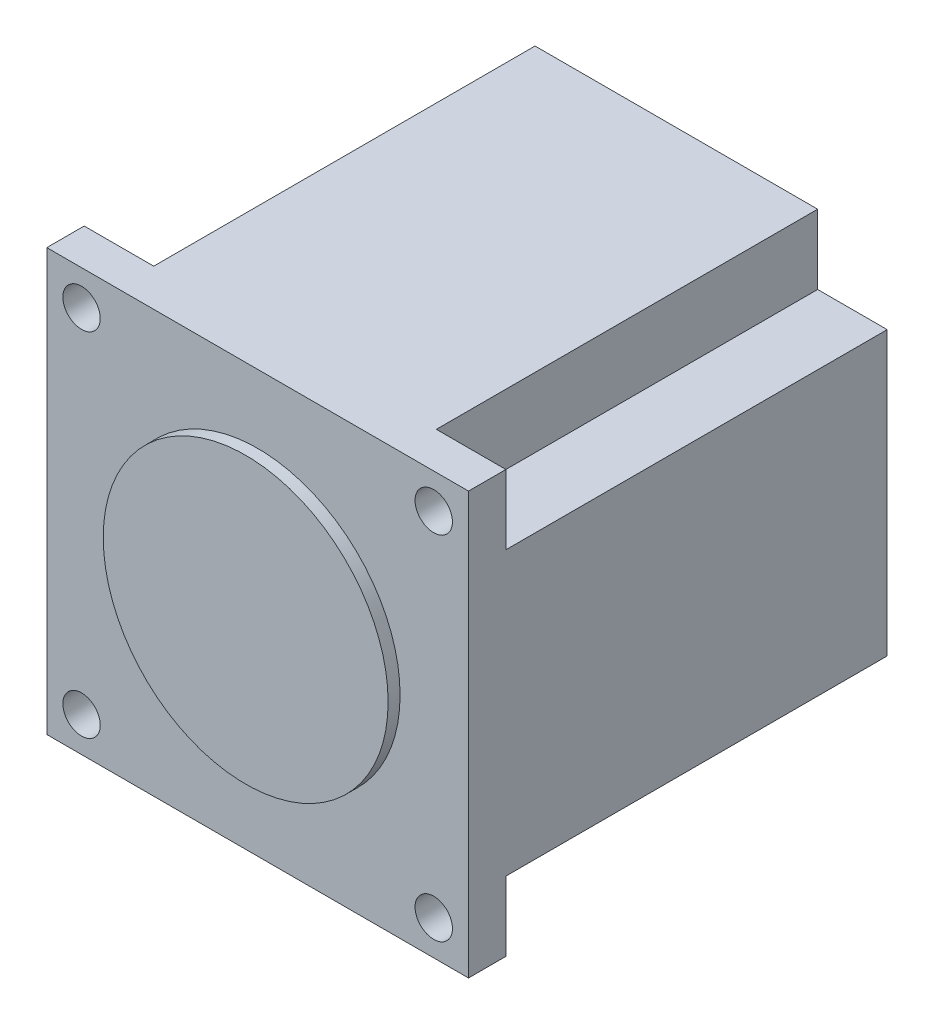
from build123d import *

# Parameters (mm, degrees)
BOSS_EXTRUDE2_DEPTH = 51
SKETCH3_W           = 56.4
SKETCH3_H           = 56.4
SKETCH3_R           = 2.5
BOSS_EXTRUDE3_DEPTH = 5
SKETCH4_R           = 19.05
BOSS_EXTRUDE4_DEPTH = 1.6


with BuildPart() as part:
    # Sketch2 → Boss-Extrude2 (new body)
    with BuildSketch(Plane.XY):
        Polygon((-18.9, 28.2), (18.9, 28.2), (18.9, 18.9), (28.2, 18.9), (28.2, -18.9), (18.9, -18.9), (18.9, -28.2), (-18.9, -28.2), (-18.9, -18.9), (-28.2, -18.9), (-28.2, 18.9), (-18.9, 18.9), align=None)
    extrude(amount=BOSS_EXTRUDE2_DEPTH)

    # Sketch3 → Boss-Extrude3 (add)
    with BuildSketch(Plane.XY.offset(51)):
        Rectangle(SKETCH3_W, SKETCH3_H)
        with Locations((-23.55, 23.55)):
            Circle(SKETCH3_R, mode=Mode.SUBTRACT)
        with Locations((23.55, 23.55)):
            Circle(SKETCH3_R, mode=Mode.SUBTRACT)
        with Locations((23.55, -23.55)):
            Circle(SKETCH3_R, mode=Mode.SUBTRACT)
        with Locations((-23.55, -23.55)):
            Circle(SKETCH3_R, mode=Mode.SUBTRACT)
    extrude(amount=BOSS_EXTRUDE3_DEPTH)

    # Sketch4 → Boss-Extrude4 (add)
    with BuildSketch(Plane.XY.offset(56)):
        Circle(SKETCH4_R)
    extrude(amount=BOSS_EXTRUDE4_DEPTH)


solid = part.part
